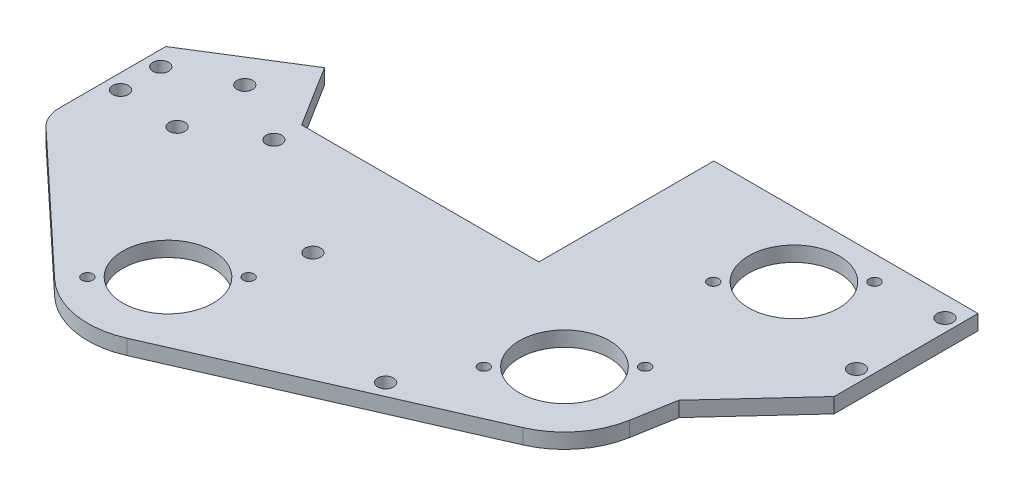
from build123d import *

# Parameters (mm, degrees)
SKETCH1_R                 = 14.29004
BOSS_EXTRUDE1_DEPTH       = 4.7625
FILLET1_R                 = 10
F_10_CLEARANCE_HOLE1_D    = 4.9784
F_10_CLEARANCE_HOLE2_D    = 4.9784
TAP_DRILL_FOR_8_32_TAP1_D = 3.4544
F_10_CLEARANCE_HOLE3_D    = 4.9784


with BuildPart() as part:
    # Sketch1 → Boss-Extrude1 (new body)
    with BuildSketch(Plane(origin=(0, 0, 0), x_dir=(1, 0, 0), z_dir=(0, 1, 0))):
        with BuildLine():
            Line((-62.038222018, -79.883349745), (25.167081601, -41.695780276))
            ThreePointArc((25.167081601, -41.695780276), (34.91524479, -34.148496119), (39.940188099, -22.890693115))
            Line((39.940188099, -22.890693115), (42.275148896, -9.586739751))
            Line((42.275148896, -9.586739751), (65.831008632, 16.012754812))
            Line((65.831008632, 16.012754812), (65.831008632, 61.493591694))
            Line((65.831008632, 61.493591694), (-17.734439664, 61.493591694))
            Line((-17.734439664, 61.493591694), (-17.734439664, 6.164335762))
            Line((-17.734439664, 6.164335762), (-92.776174625, 6.164335762))
            Line((-92.776174625, 6.164335762), (-104.850431309, 25.487185645))
            Line((-104.850431309, 25.487185645), (-135.754362541, 6.176266165))
            Line((-135.754362541, 6.176266165), (-135.754362541, -31.923733805))
            Line((-135.754362541, -31.923733805), (-89.58881583, -75.156212804))
            ThreePointArc((-89.58881583, -75.156212804), (-76.522282462, -81.650581076), (-62.038222018, -79.883349745))
        make_face()
        with Locations((28.046575186, 41.045834415)):
            Circle(SKETCH1_R, mode=Mode.SUBTRACT)
        with Locations((15.031008632, -18.508482198)):
            Circle(SKETCH1_R, mode=Mode.SUBTRACT)
        with Locations((-72.258332946, -56.628468385)):
            Circle(SKETCH1_R, mode=Mode.SUBTRACT)
    extrude(amount=BOSS_EXTRUDE1_DEPTH)

    # Fillet1
    fillet1_edges = [part.edges().sort_by_distance(p)[0] for p in [
        (-135.754362541, 2.38125, 31.923733805),
    ]]
    fillet(fillet1_edges, radius=FILLET1_R)

    # #10 Clearance Hole1 (through all)
    with Locations(Plane(origin=(0, 4.7625, 0), x_dir=(1, 0, 0), z_dir=(0, 1, 0))):
        with Locations((61.830508632, 55.015834415), (61.830508632, 27.075834415), (-130.991862541, -0.185664238), (-130.991862541, -12.885664238)):
            Hole(F_10_CLEARANCE_HOLE1_D / 2)

    # #10 Clearance Hole2 (through all)
    with Locations(Plane(origin=(0, 4.7625, 0), x_dir=(1, 0, 0), z_dir=(0, 1, 0))):
        with Locations((-111.967153366, -14.051247514), (-93.119284429, -2.273791866), (-112.732400526, 8.143579493)):
            Hole(F_10_CLEARANCE_HOLE2_D / 2)

    # Tap Drill for #8-32 Tap1 (through all)
    with Locations(Plane(origin=(0, 4.7625, 0), x_dir=(1, 0, 0), z_dir=(0, 1, 0))):
        with Locations((-59.506369254, -43.876504694), (-85.010296638, -69.380432077), (2.27904494, -31.26044589), (27.782972324, -5.756518506), (15.294611495, 28.293870723), (40.798538878, 53.797798107)):
            Hole(TAP_DRILL_FOR_8_32_TAP1_D / 2)

    # #10 Clearance Hole3 (through all)
    with Locations(Plane(origin=(0, 4.7625, 0), x_dir=(1, 0, 0), z_dir=(0, 1, 0))):
        with Locations((-56.041369259, -27.019222928), (-8.951277081, -51.090630662)):
            Hole(F_10_CLEARANCE_HOLE3_D / 2)


solid = part.part
